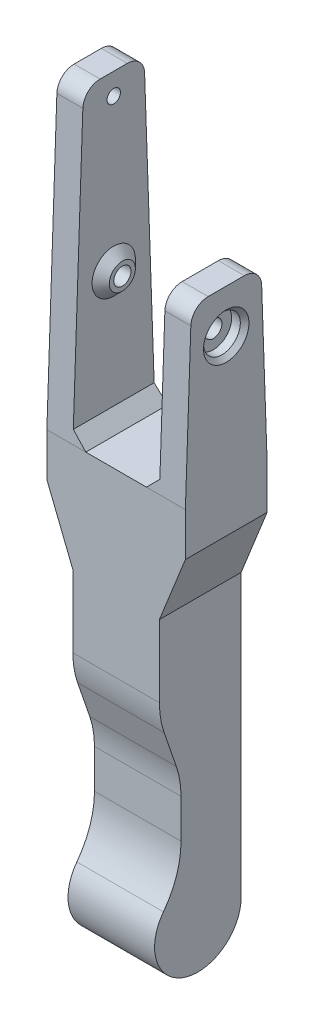
from build123d import *

# Parameters (mm, degrees)
SKETCH1_R           = 2
BOSS_EXTRUDE1_DEPTH = 6
SKETCH2_R           = 4.25
CUT_EXTRUDE1_DEPTH  = 3
SKETCH3_W           = 18.888907728
SKETCH3_H           = 10
BOSS_EXTRUDE2_DEPTH = 32
BOSS_EXTRUDE3_START = -6
SKETCH4_R           = 2
BOSS_EXTRUDE3_DEPTH = 6
FILLET1_R           = 4
CUT_EXTRUDE2_START  = -29
SKETCH2_2_R         = 4.25
CUT_EXTRUDE2_DEPTH  = 3
CHAMFER1_SIZE       = 1
CHAMFER2_SIZE       = 3
SKETCH5_R           = 3
SKETCH5_R_2         = 2
BOSS_EXTRUDE4_DEPTH = 2
BOSS_EXTRUDE5_START = 18
SKETCH5_2_R         = 3
SKETCH5_2_R_2       = 2
BOSS_EXTRUDE5_DEPTH = 2
CHAMFER4_SIZE       = 2
BOSS_EXTRUDE6_DEPTH = 18.888907729
BOSS_EXTRUDE7_DEPTH = 20
CHAMFER5_SIZE       = 15
CHAMFER5_SIZE_2     = 5.164914199
FILLET2_R           = 20
SKETCH9_R           = 1.55
CUT_EXTRUDE3_DEPTH  = 6
CUT_EXTRUDE4_START  = -3
SKETCH10_R          = 3.25
SKETCH10_R_2        = 1.55
CUT_EXTRUDE4_DEPTH  = 3
CHAMFER6_SIZE       = 1


# Some blends are built 0.0001 mm under size
with BuildPart() as part:
    # Sketch1 → Boss-Extrude1 (new body)
    with BuildSketch(Plane(origin=(0, 0, 0), x_dir=(0, 0, -1), z_dir=(1, 0, 0))):
        Polygon((-9.444453864, -30), (-7, 40), (7, 40), (9.444453864, -30), align=None)
        Circle(SKETCH1_R, mode=Mode.SUBTRACT)
    extrude(amount=BOSS_EXTRUDE1_DEPTH)

    # Sketch2 → Cut-Extrude1 (cut)
    with BuildSketch(Plane.ZY):
        Circle(SKETCH2_R)
    extrude(amount=-CUT_EXTRUDE1_DEPTH, mode=Mode.SUBTRACT)

    # Sketch3 → Boss-Extrude2 (add)
    with BuildSketch(Plane.ZY):
        with Locations((0, -35)):
            Rectangle(SKETCH3_W, SKETCH3_H)
    extrude(amount=-BOSS_EXTRUDE2_DEPTH)

    # Sketch4 → Boss-Extrude3 (add)
    with BuildSketch(Plane(origin=(32, 0, 0), x_dir=(0, 0, -1), z_dir=(1, 0, 0)).offset(BOSS_EXTRUDE3_START)):
        Polygon((9.444453864, -30), (-9.444453864, -30), (-8.047623085, 10), (8.047623085, 10), align=None)
        with Locations(Location((0, 0, 0), (0, 0, 180))):
            Circle(SKETCH4_R, mode=Mode.SUBTRACT)
    extrude(amount=BOSS_EXTRUDE3_DEPTH)

    # Fillet1
    fillet1_edges = [part.edges().sort_by_distance(p)[0] for p in [
        (29, 10, -8.047623085),
        (29, 10, 8.047623085),
        (3, 40, 7),
        (3, 40, -7),
    ]]
    fillet(fillet1_edges, radius=FILLET1_R)

    # Sketch2<2> → Cut-Extrude2 (cut)
    with BuildSketch(Plane.ZY.offset(CUT_EXTRUDE2_START)):
        Circle(SKETCH2_2_R)
    extrude(amount=-CUT_EXTRUDE2_DEPTH, mode=Mode.SUBTRACT)

    # Chamfer1
    chamfer1_edges = [part.edges().sort_by_distance(p)[0] for p in [
        (0, 0, -4.25),
        (32, 0, -4.25),
    ]]
    chamfer(chamfer1_edges, length=CHAMFER1_SIZE)

    # Chamfer2
    chamfer2_edges = [part.edges().sort_by_distance(p)[0] for p in [
        (26, -30, 0),
        (6, -30, 0),
    ]]
    chamfer(chamfer2_edges, length=CHAMFER2_SIZE)

    # Sketch5 → Boss-Extrude4 (add)
    with BuildSketch(Plane(origin=(6, 0, 0), x_dir=(0, 0, -1), z_dir=(1, 0, 0))):
        with Locations(Location((0, 0, 0), (0, 0, 180))):
            Circle(SKETCH5_R)
        with Locations(Location((0, 0, 0), (0, 0, 180))):
            Circle(SKETCH5_R_2, mode=Mode.SUBTRACT)
    extrude(amount=BOSS_EXTRUDE4_DEPTH)

    # Sketch5<2> → Boss-Extrude5 (add)
    with BuildSketch(Plane(origin=(6, 0, 0), x_dir=(0, 0, -1), z_dir=(1, 0, 0)).offset(BOSS_EXTRUDE5_START)):
        with Locations(Location((0, 0, 0), (0, 0, 180))):
            Circle(SKETCH5_2_R)
        with Locations(Location((0, 0, 0), (0, 0, 180))):
            Circle(SKETCH5_2_R_2, mode=Mode.SUBTRACT)
    extrude(amount=BOSS_EXTRUDE5_DEPTH)

    # Chamfer4
    chamfer4_edges = [part.edges().sort_by_distance(p)[0] for p in [
        (6, 0, -3),
        (26, 0, -3),
    ]]
    chamfer(chamfer4_edges, length=CHAMFER4_SIZE - 0.0001)  # a hair under: the kernel refuses the full size

    # Sketch7 → Boss-Extrude6 (add)
    with BuildSketch(Plane(origin=(0, 0, -9.444453864), x_dir=(-1, 0, 0), z_dir=(0, 0, -1))):
        Polygon((-32, -40), (-26, -55), (-26, -60), (-6, -60), (-6, -55), (0, -40), align=None)
    extrude(amount=-BOSS_EXTRUDE6_DEPTH)

    # Sketch8 → Boss-Extrude7 (add)
    with BuildSketch(Plane(origin=(26, 0, 0), x_dir=(0, 0, -1), z_dir=(1, 0, 0))):
        with BuildLine():
            Line((9.444453864, -60), (-9.444453864, -60))
            Line((-9.444453864, -60), (-9.444453864, -90))
            Line((-9.444453864, -90), (-4.444453864, -90))
            Line((-4.444453864, -90), (-4.444453864, -110.787161313))
            ThreePointArc((-4.444453864, -110.787161313), (-6.083245599, -128.333338985), (9.444453864, -120))
            Line((9.444453864, -120), (9.444453864, -60))
        make_face()
    extrude(amount=-BOSS_EXTRUDE7_DEPTH)

    # Chamfer5
    # the kernel refuses this chamfer: 15, 5.164914199 mm, written as the material it takes off along each edge
    with BuildSketch(Plane(origin=(64.9213417, -90, 9.444453864), x_dir=(0, 0.9999212813122312, 0.012547158200392249), z_dir=(-1, 0, 0))) as chamfer5_piece_1_section:
        Polygon((CHAMFER5_SIZE * 0.999921281312, CHAMFER5_SIZE * 0.0125471582004), (-CHAMFER5_SIZE_2 * 0.0125471582012, CHAMFER5_SIZE_2 * 0.999921281379), (0, 0), align=None)
    chamfer5_piece_1 = extrude(amount=97.842683401, mode=Mode.PRIVATE)
    chamfer5_piece_1 = split(chamfer5_piece_1, bisect_by=Plane(origin=(16, -84.819367326, 4.444453864), z_dir=(0, 0, 1)), keep=Keep.TOP, mode=Mode.PRIVATE)
    add(chamfer5_piece_1, mode=Mode.SUBTRACT)

    # Fillet2
    fillet2_edges = [part.edges().sort_by_distance(p)[0] for p in [
        (16, -110.787161313, 4.444453864),
        (16, -75, 9.444453864),
        (16, -89.521054388, 4.444453864),
    ]]
    fillet(fillet2_edges, radius=FILLET2_R)

    # Sketch9 → Cut-Extrude3 (cut)
    with BuildSketch(Plane(origin=(6, 0, 0), x_dir=(0, 0, -1), z_dir=(1, 0, 0))):
        with Locations((0, 35)):
            Circle(SKETCH9_R)
    extrude(amount=-CUT_EXTRUDE3_DEPTH, mode=Mode.SUBTRACT)

    # Sketch10 → Cut-Extrude4 (cut)
    with BuildSketch(Plane.ZY.offset(CUT_EXTRUDE4_START)):
        with Locations((0, 35)):
            Circle(SKETCH10_R)
        with Locations(Location((0, 35, 0), (0, 0, 180))):
            Circle(SKETCH10_R_2, mode=Mode.SUBTRACT)
    extrude(amount=CUT_EXTRUDE4_DEPTH, mode=Mode.SUBTRACT)

    # Chamfer6
    chamfer6_edges = [part.edges().sort_by_distance(p)[0] for p in [
        (0, 35, -3.25),
    ]]
    chamfer(chamfer6_edges, length=CHAMFER6_SIZE)


solid = part.part
